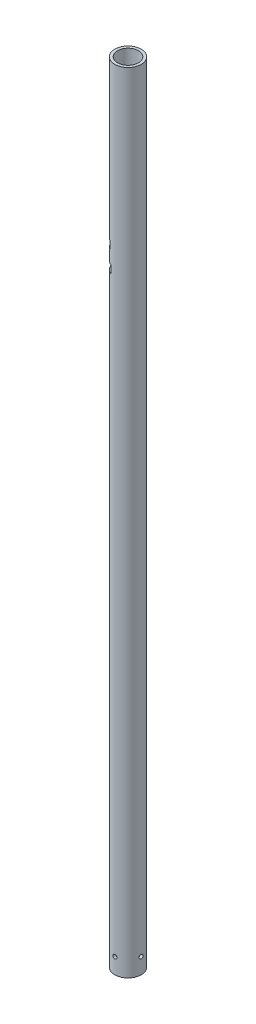
from build123d import *

# Parameters (mm, degrees)
SKETCH1_R                            = 16.7005
SKETCH1_R_2                          = 13.3225
BOSS_EXTRUDE1_DEPTH                  = 1000
F_8_0_199_DIAMETER_HOLE3_D           = 5.0546
F_8_0_199_DIAMETER_HOLE3_ON_FACE_2_D = 5.0546
SKETCH13_W                           = 25
SKETCH13_H                           = 10
CUT_EXTRUDE2_DEPTH                   = 5
CRVPATTERN1_START                    = -776.134502112
CRVPATTERN1_DEPTH                    = 10.000000747
CRVPATTERN1_START_2                  = -801.120273528
CRVPATTERN1_2_DEPTH                  = 10.000000087
CRVPATTERN1_START_3                  = -826.107363022
CRVPATTERN1_3_DEPTH                  = 10.000000837
CRVPATTERN1_START_4                  = -851.094461799
CRVPATTERN1_4_DEPTH                  = 10.000001603
CRVPATTERN1_START_5                  = -876.080226043
CRVPATTERN1_5_DEPTH                  = 9.999999042
CRVPATTERN1_START_6                  = -901.067323955
CRVPATTERN1_6_DEPTH                  = 10.000000872
CRVPATTERN1_START_7                  = -926.054423082
CRVPATTERN1_7_DEPTH                  = 10


# Read off the part's stored shape, not the designer's step: CrvPattern1
with BuildPart() as part:
    # Sketch1 → Boss-Extrude1 (new body)
    with BuildSketch(Plane(origin=(0, 0, 0), x_dir=(1, 0, 0), z_dir=(0, 1, 0))):
        with Locations(Location((0, 0, 0), (0, 0, 270))):
            Circle(SKETCH1_R)
        with Locations(Location((0, 0, 0), (0, 0, 270))):
            Circle(SKETCH1_R_2, mode=Mode.SUBTRACT)
    extrude(amount=BOSS_EXTRUDE1_DEPTH)

    # #8 (0.199) Diameter Hole3 (through all)
    with Locations(Plane(origin=(-16.7005, 20, 0), x_dir=(0, 0, -1), z_dir=(-1, 0, 0))):
        with Locations((0, 0)):
            Hole(F_8_0_199_DIAMETER_HOLE3_D / 2)

    # #8 (0.199) Diameter Hole3 on face 2 (through all)
    with Locations(Plane(origin=(0, 20, -16.7005), x_dir=(-1, 0, 0), z_dir=(0, 0, -1))):
        with Locations((0, 0)):
            Hole(F_8_0_199_DIAMETER_HOLE3_ON_FACE_2_D / 2)

    # Sketch13 → Cut-Extrude2 (cut)
    with BuildSketch(Plane(origin=(-8.35025, 0, -8.35025), x_dir=(0.7071067811865476, 0, -0.7071067811865475), z_dir=(0.7071067811865475, 0, 0.7071067811865476))):
        with Locations((-2.7995, 946.040178561)):
            Rectangle(SKETCH13_W, SKETCH13_H)
    extrude(amount=-CUT_EXTRUDE2_DEPTH, mode=Mode.SUBTRACT)

    # CrvPattern1 outline → CrvPattern1 (cut)
    with BuildSketch(Plane(origin=(0, 0, 0), x_dir=(0.9999999999999967, 8.202761047245753e-08, 1.806936440011125e-15), z_dir=(8.202761047245755e-08, -0.9999999999999964, -2.2028392996012417e-08)).offset(CRVPATTERN1_START)):
        Polygon((-5.722176693, 15.689555254), (-5.577662721, 16), (-17, 16), (-17, -2.786415731), (-16.418222904, -3.057236609), (-14.799661039, -3.810687284), (-13.308577574, -0.607542292), (-8.103108157, 10.574841053), align=None)
    extrude(amount=CRVPATTERN1_DEPTH, mode=Mode.SUBTRACT)

    # CrvPattern1 2 outline → CrvPattern1 2 (cut)
    with BuildSketch(Plane(origin=(0, 0, 0), x_dir=(0.9999999999999967, 8.202761047245753e-08, 1.806936440011125e-15), z_dir=(8.202761047245755e-08, -0.9999999999999964, -2.2028392996012417e-08)).offset(CRVPATTERN1_START_2)):
        Polygon((-8.358270095, 14.45836888), (-7.946114962, 16), (-17, 16), (-17, -5.496243368), (-15.638491988, -5.860242582), (-13.913729951, -6.321357772), (-13.001180883, -2.908042908), (-12.517773257, -1.099897915), (-13.028337492, -0.005530874), (-11.141602741, 4.047550522), (-9.81541056, 9.008059256), align=None)
    extrude(amount=CRVPATTERN1_2_DEPTH, mode=Mode.SUBTRACT)

    # CrvPattern1 3 outline → CrvPattern1 3 (cut)
    with BuildSketch(Plane(origin=(0, 0, 0), x_dir=(0.9999999999999967, 8.202761047245753e-08, 1.806936440011125e-15), z_dir=(8.202761047245755e-08, -0.9999999999999964, -2.2028392996012417e-08)).offset(CRVPATTERN1_START_3)):
        Polygon((-12.29914845, -5.120398412), (-12.136898195, -3.255797163), (-12.829690253, -2.266596834), (-12.517773256, -1.099897915), (-13.028337492, -0.005530874), (-11.584105766, 3.09696604), (-11.229879817, 7.167777165), (-10.740806582, 12.788271019), (-10.461334578, 16), (-17, 16), (-17, -5.496243368), (-15.740986646, -5.832840632), (-16.874930818, -8.268778183), (-14.384051934, -8.485524651), (-12.605435511, -8.640292846), align=None)
    extrude(amount=CRVPATTERN1_3_DEPTH, mode=Mode.SUBTRACT)

    # CrvPattern1 4 outline → CrvPattern1 4 (cut)
    with BuildSketch(Plane(origin=(0, 0, 0), x_dir=(0.9999999999999967, 8.202761047245753e-08, 1.806936440011125e-15), z_dir=(8.202761047245755e-08, -0.9999999999999964, -2.2028392996012417e-08)).offset(CRVPATTERN1_START_4)):
        Polygon((-11.22379565, -7.17733335), (-11.486820658, -4.184007735), (-12.829690253, -2.266596835), (-12.517773256, -1.099897915), (-13.028337492, -0.005530874), (-12.040460427, 2.116625487), (-12.303483571, 5.109929881), (-12.797322623, 10.73000797), (-13.260399439, 16), (-17, 16), (-17, -5.496243368), (-15.740986646, -5.832840632), (-16.874930818, -8.268778183), (-14.489859341, -8.476317707), (-15.183845812, -11.072114908), (-12.69300799, -10.853243753), (-10.914523633, -10.69696745), align=None)
    extrude(amount=CRVPATTERN1_4_DEPTH, mode=Mode.SUBTRACT)

    # CrvPattern1 5 outline → CrvPattern1 5 (cut)
    with BuildSketch(Plane(origin=(0, 0, 0), x_dir=(0.9999999999999967, 8.202761047245753e-08, 1.806936440011125e-15), z_dir=(8.202761047245755e-08, -0.9999999999999964, -2.2028392996012417e-08)).offset(CRVPATTERN1_START_5)):
        Polygon((-9.807846349, -9.016324346), (-10.866525414, -5.069693782), (-12.829690253, -2.266596835), (-12.517773256, -1.099897915), (-13.028337492, -0.005530874), (-12.518675116, 1.089325248), (-13.003609013, 2.89710156), (-14.465319948, 8.34618735), (-16.518446303, 16), (-17, 16), (-17, -5.496243368), (-15.740986646, -5.832840632), (-16.874930818, -8.268778183), (-14.489859341, -8.476317707), (-15.183845812, -11.072114908), (-12.798807024, -10.862540367), (-13.031722164, -13.539231748), (-10.616808233, -12.89143389), (-8.89243346, -12.428872359), align=None)
    extrude(amount=CRVPATTERN1_5_DEPTH, mode=Mode.SUBTRACT)

    # CrvPattern1 6 outline → CrvPattern1 6 (cut)
    with BuildSketch(Plane(origin=(0, 0, 0), x_dir=(0.9999999999999967, 8.202761047245753e-08, 1.806936440011125e-15), z_dir=(8.202761047245755e-08, -0.9999999999999964, -2.2028392996012417e-08)).offset(CRVPATTERN1_START_6)):
        Polygon((-8.218250116, -14.538446942), (-6.600328013, -13.783624172), (-8.094127844, -10.581744479), (-10.265023897, -5.928545282), (-12.829690253, -2.266596835), (-12.517773256, -1.099897915), (-13.309076973, 0.596219138), (-15.694345506, 5.708914242), (-17, 8.507514587), (-17, -5.496243368), (-15.740986646, -5.832840632), (-16.874930818, -8.268778183), (-14.489859341, -8.476317707), (-15.183845812, -11.072114908), (-12.798807024, -10.862540367), (-13.031722164, -13.539231748), (-10.719279434, -12.918921671), (-10.484083207, -15.59554506), align=None)
    extrude(amount=CRVPATTERN1_6_DEPTH, mode=Mode.SUBTRACT)

    # CrvPattern1 7 outline → CrvPattern1 7 (cut)
    with BuildSketch(Plane(origin=(0, 0, 0), x_dir=(0.9999999999999967, 8.202761047245753e-08, 1.806936440011125e-15), z_dir=(8.202761047245755e-08, -0.9999999999999964, -2.2028392996012417e-08)).offset(CRVPATTERN1_START_7)):
        Polygon((-5.570240674, -15.744170901), (-4.10787995, -14.719998278), (-6.134724894, -11.825975951), (-13.210570485, -1.72275854), (-16.446994838, 2.898356838), (-17, 3.687963014), (-17, -5.496243368), (-15.740986646, -5.832840632), (-16.874930818, -8.268778183), (-14.489859341, -8.476317707), (-15.183845812, -11.072114908), (-12.798807024, -10.862540367), (-13.031722164, -13.539231748), (-10.719279434, -12.918921671), (-10.484083207, -15.59554506), (-8.314498097, -14.58335032), (-7.934483465, -16), (-5.935525215, -16), align=None)
    extrude(amount=CRVPATTERN1_7_DEPTH, mode=Mode.SUBTRACT)


solid = part.part
